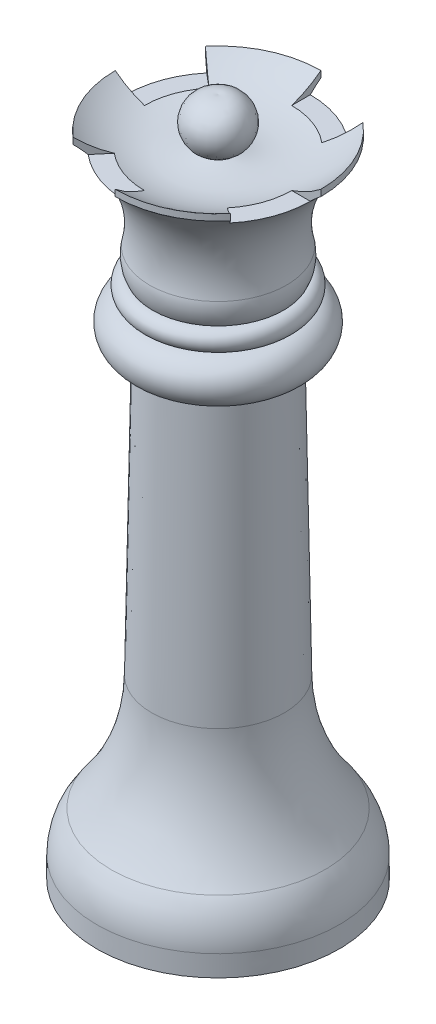
from build123d import *

# Parameters (mm, degrees)
SKETCH10_W          = 9.512793273
SKETCH10_H          = 11.722214066
CUT_REVOLVE8_ANGLE  = 40
SKETCH11_W          = 6.957754191
SKETCH11_H          = 10.596103561
CUT_REVOLVE9_ANGLE  = 40
SKETCH12_W          = 9.203214596
SKETCH12_H          = 11.66204652
CUT_REVOLVE10_ANGLE = 40
SKETCH13_W          = 8.638104201
SKETCH13_H          = 11.887108819
CUT_REVOLVE11_ANGLE = 40
CUT_EXTRUDE1_START  = -0.4
SKETCH8_R           = 10
CUT_EXTRUDE1_DEPTH  = 2


with BuildPart() as part:
    # Sketch1 → Revolve6 (revolve)
    with BuildSketch(Plane.XY):
        with BuildLine():
            Line((-11.6, 0), (0, 0))
            Line((0, 0), (0, 65))
            ThreePointArc((0, 65), (-2.670285452, 63.315824128), (-1.207945055, 60.517890367))
            ThreePointArc((-1.207945055, 60.517890367), (-5.713617748, 60.221219504), (-9.83725582, 62.060977386))
            Line((-9.83725582, 62.060977386), (-9.83725582, 61.446621373))
            ThreePointArc((-9.83725582, 61.446621373), (-6.855122072, 57.446707659), (-6.5462636, 52.467045236))
            ThreePointArc((-6.5462636, 52.467045236), (-6.602958864, 51.327795265), (-6.259730665, 50.239999672))
            ThreePointArc((-6.259730665, 50.239999672), (-7.244947935, 49.268175675), (-6.286634877, 48.269811497))
            ThreePointArc((-6.286634877, 48.269811497), (-8.418356224, 46.223574851), (-6.343236917, 44.119958876))
            Line((-6.343236917, 44.119958876), (-5.873433999, 44.119958876))
            Line((-5.873433999, 44.119958876), (-6.343236917, 16.936018409))
            ThreePointArc((-6.343236917, 16.936018409), (-7.365159743, 11.085952185), (-10.229600334, 5.88378137))
            ThreePointArc((-10.229600334, 5.88378137), (-11.234646656, 4.055708482), (-11.589655426, 2))
            Line((-11.589655426, 2), (-11.6, 0))
        make_face()
    revolve(axis=Axis((0, 65, 0), (0, -1, 0)))

    # Sketch10 → Cut-Revolve8 (revolve, cut)
    with BuildSketch(Plane.XY):
        with Locations((-9.83725582, 66.422084419)):
            Rectangle(SKETCH10_W, SKETCH10_H)
    revolve(axis=Axis((0, 0, 0), (0, -1, 0)), revolution_arc=CUT_REVOLVE8_ANGLE, mode=Mode.SUBTRACT)

    # Sketch11 → Cut-Revolve9 (revolve, cut)
    with BuildSketch(Plane.XY):
        with Locations((9.83725582, 65.859029167)):
            Rectangle(SKETCH11_W, SKETCH11_H)
    revolve(axis=Axis((0, 0, 0), (0, -1, 0)), revolution_arc=CUT_REVOLVE9_ANGLE, mode=Mode.SUBTRACT)

    # Sketch12 → Cut-Revolve10 (revolve, cut)
    with BuildSketch(Plane(origin=(0, 0, 0), x_dir=(0, 0, -1), z_dir=(1, 0, 0))):
        with Locations((9.83725582, 66.392000646)):
            Rectangle(SKETCH12_W, SKETCH12_H)
    revolve(axis=Axis((0, 0, 0), (0, -1, 0)), revolution_arc=CUT_REVOLVE10_ANGLE, mode=Mode.SUBTRACT)

    # Sketch13 → Cut-Revolve11 (revolve, cut)
    with BuildSketch(Plane(origin=(0, 0, 0), x_dir=(0, 0, -1), z_dir=(1, 0, 0))):
        with Locations((-9.83725582, 66.504531796)):
            Rectangle(SKETCH13_W, SKETCH13_H)
    revolve(axis=Axis((0, 0, 0), (0, -1, 0)), revolution_arc=CUT_REVOLVE11_ANGLE, mode=Mode.SUBTRACT)

    # Sketch8 → Cut-Extrude1 (cut)
    with BuildSketch(Plane.XZ.offset(CUT_EXTRUDE1_START)):
        Circle(SKETCH8_R)
    extrude(amount=-CUT_EXTRUDE1_DEPTH, mode=Mode.SUBTRACT)


solid = part.part
